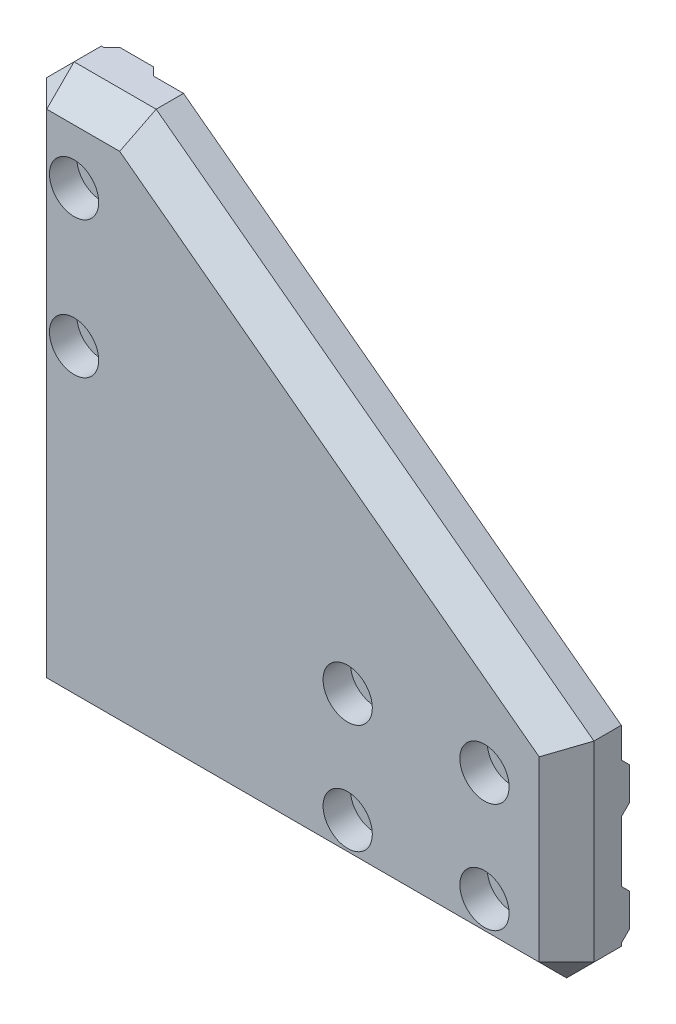
from build123d import *

# Parameters (mm, degrees)
BOSS_EXTRUDE1_DEPTH     = 10
SKETCH2_R               = 2.6
CUT_EXTRUDE1_DEPTH      = 142.774468788
SKETCH3_W               = 60
SKETCH3_H               = 9
SKETCH3_W_2             = 9
SKETCH3_H_2             = 60
BOSS_EXTRUDE3_DEPTH     = 1.46
CUT_EXTRUDE2_DEPTH      = 142.774468788
CUT_EXTRUDE2_DEPTH_BACK = 142.774468788
SKETCH2_2_R             = 2.6
CHAMFER1_SIZE           = 1.46
CUT_EXTRUDE3_START      = 10
SKETCH4_R               = 4.5
CUT_EXTRUDE3_DEPTH      = 5
CHAMFER2_SIZE           = 5


with BuildPart() as part:
    # Sketch1 → Boss-Extrude1 (new body)
    with BuildSketch(Plane.XY):
        Polygon((0, 0), (100, 0), (100, 40), (20, 100), (0, 100), align=None)
    extrude(amount=BOSS_EXTRUDE1_DEPTH)

    # Sketch2 → Cut-Extrude1 (cut, through all)
    with BuildSketch(Plane.XY):
        with Locations((10, 85)):
            Circle(SKETCH2_R)
        with Locations((10, 60)):
            Circle(SKETCH2_R)
        with Locations((85, 30)):
            Circle(SKETCH2_R)
        with Locations((85, 10)):
            Circle(SKETCH2_R)
        with Locations((60, 10)):
            Circle(SKETCH2_R)
        with Locations((60, 30)):
            Circle(SKETCH2_R)
    extrude(amount=CUT_EXTRUDE1_DEPTH, mode=Mode.SUBTRACT)

    # Sketch3 → Boss-Extrude3 (add)
    with BuildSketch(Plane.XY):
        with Locations((70, 30)):
            Rectangle(SKETCH3_W, SKETCH3_H)
        with Locations((70, 10)):
            Rectangle(SKETCH3_W, SKETCH3_H)
        with Locations((10, 70)):
            Rectangle(SKETCH3_W_2, SKETCH3_H_2)
    extrude(amount=-BOSS_EXTRUDE3_DEPTH)

    # Sketch2<2> → Cut-Extrude2 (cut, two sides: drawn at the far end of the back side and taken through both)
    with BuildSketch(Plane.XY.offset(-CUT_EXTRUDE2_DEPTH_BACK)):
        with Locations((10, 85)):
            Circle(SKETCH2_2_R)
        with Locations((10, 60)):
            Circle(SKETCH2_2_R)
        with Locations((85, 30)):
            Circle(SKETCH2_2_R)
        with Locations((85, 10)):
            Circle(SKETCH2_2_R)
        with Locations((60, 10)):
            Circle(SKETCH2_2_R)
        with Locations((60, 30)):
            Circle(SKETCH2_2_R)
    extrude(amount=CUT_EXTRUDE2_DEPTH + CUT_EXTRUDE2_DEPTH_BACK, mode=Mode.SUBTRACT)

    # Chamfer1
    chamfer1_edges = [part.edges().sort_by_distance(p)[0] for p in [
        (14.5, 70, -1.46),
        (5.5, 70, -1.46),
        (70, 5.5, -1.46),
        (70, 14.5, -1.46),
        (70, 25.5, -1.46),
        (70, 34.5, -1.46),
    ]]
    chamfer(chamfer1_edges, length=CHAMFER1_SIZE - 0.0001)  # a hair under: the kernel refuses the full size

    # Sketch4 → Cut-Extrude3 (cut)
    with BuildSketch(Plane.XY.offset(CUT_EXTRUDE3_START)):
        with Locations((10, 85)):
            Circle(SKETCH4_R)
        with Locations((10, 60)):
            Circle(SKETCH4_R)
        with Locations((60, 30)):
            Circle(SKETCH4_R)
        with Locations((85, 30)):
            Circle(SKETCH4_R)
        with Locations((85, 10)):
            Circle(SKETCH4_R)
        with Locations((60, 10)):
            Circle(SKETCH4_R)
    extrude(amount=-CUT_EXTRUDE3_DEPTH, mode=Mode.SUBTRACT)

    # Chamfer2
    chamfer2_edges = [part.edges().sort_by_distance(p)[0] for p in [
        (100, 20, 10),
        (60, 70, 10),
        (10, 100, 10),
        (0, 50, 10),
        (50, 0, 10),
        (0, 100, 5),
        (100, 0, 5),
        (0, 0, 5),
    ]]
    chamfer(chamfer2_edges, length=CHAMFER2_SIZE)


solid = part.part
